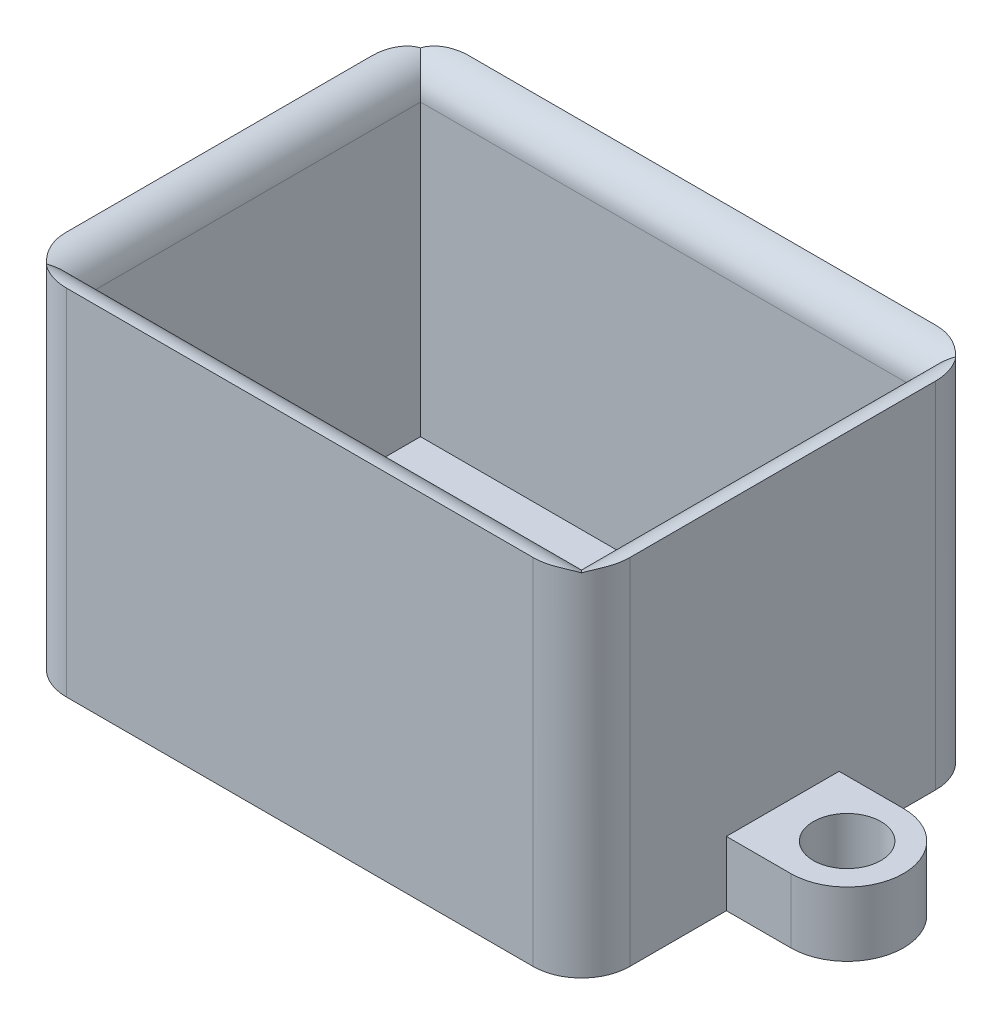
from build123d import *

# Parameters (mm, degrees)
SKETCH2_W           = 35
SKETCH2_H           = 25
SKETCH2_W_2         = 31
SKETCH2_H_2         = 21
BOSS_EXTRUDE1_DEPTH = 20
SKETCH3_W           = 35
SKETCH3_H           = 25
BOSS_EXTRUDE2_DEPTH = 2
SKETCH4_R           = 2.1
BOSS_EXTRUDE3_DEPTH = 4
FILLET1_R           = 3
FILLET2_R           = 2


with BuildPart() as part:
    # Sketch2 → Boss-Extrude1 (new body)
    with BuildSketch(Plane(origin=(0, 0, 0), x_dir=(1, 0, 0), z_dir=(0, 1, 0))):
        Rectangle(SKETCH2_W, SKETCH2_H)
        Rectangle(SKETCH2_W_2, SKETCH2_H_2, mode=Mode.SUBTRACT)
    extrude(amount=BOSS_EXTRUDE1_DEPTH)

    # Sketch3 → Boss-Extrude2 (add)
    with BuildSketch(Plane.XZ):
        Rectangle(SKETCH3_W, SKETCH3_H)
    extrude(amount=BOSS_EXTRUDE2_DEPTH)

    # Sketch4 → Boss-Extrude3 (add)
    # profile 1 of 2: a face of its own
    with BuildSketch(Plane.XZ.offset(2)):
        with BuildLine():
            Line((-21.5, 3.5), (-17.5, 3.5))
            Line((-17.5, 3.5), (-17.5, -3.5))
            Line((-17.5, -3.5), (-21.5, -3.5))
            ThreePointArc((-21.5, -3.5), (-25, 0), (-21.5, 3.5))
        make_face()
        with Locations(Location((-21.5, 0, 0), (0, 0, 270))):
            Circle(SKETCH4_R, mode=Mode.SUBTRACT)
    # profile 2 of 2: a face of its own
    with BuildSketch(Plane.XZ.offset(2)):
        with BuildLine():
            Line((17.5, 3.5), (17.5, -3.5))
            Line((17.5, -3.5), (21.5, -3.5))
            ThreePointArc((21.5, -3.5), (25, 0), (21.5, 3.5))
            Line((21.5, 3.5), (17.5, 3.5))
        make_face()
        with Locations(Location((21.5, 0, 0), (0, 0, 90))):
            Circle(SKETCH4_R, mode=Mode.SUBTRACT)
    extrude(amount=-BOSS_EXTRUDE3_DEPTH)

    # Fillet1
    fillet1_edges = [part.edges().sort_by_distance(p)[0] for p in [
        (17.5, 9, 12.5),
        (-17.5, 9, 12.5),
        (-17.5, 9, -12.5),
        (17.5, 9, -12.5),
    ]]
    fillet(fillet1_edges, radius=FILLET1_R)

    # Fillet2
    # the kernel refuses this fillet: 2 mm, written as the material it takes off along each edge
    with BuildSketch(Plane(origin=(15.5, 20, -10.5), x_dir=(1, 0, 0), z_dir=(0, 0, 1)), Plane(origin=(-15.5, 20, 10.5), x_dir=(-1, 0, 0), z_dir=(0, 0, -1))) as fillet2_piece_1:
        with BuildLine():
            CenterArc((FILLET2_R, -FILLET2_R), FILLET2_R, 90, 90)
            Line((0, -FILLET2_R), (-FILLET2_R * 0.02, -FILLET2_R))
            Line((-FILLET2_R * 0.02, -FILLET2_R), (-FILLET2_R * 0.02, FILLET2_R * 0.02))
            Line((-FILLET2_R * 0.02, FILLET2_R * 0.02), (FILLET2_R, FILLET2_R * 0.02))
            Line((FILLET2_R, FILLET2_R * 0.02), (FILLET2_R, 0))
        make_face()
    extrude(amount=21, mode=Mode.SUBTRACT)
    with BuildSketch(Plane(origin=(-15.5, 20, -10.5), x_dir=(0, 0, -1), z_dir=(1, 0, 0)), Plane(origin=(15.5, 20, 10.5), x_dir=(0, 0, 1), z_dir=(-1, 0, 0))) as fillet2_piece_2:
        with BuildLine():
            CenterArc((FILLET2_R, -FILLET2_R), FILLET2_R, 90, 90)
            Line((0, -FILLET2_R), (-FILLET2_R * 0.02, -FILLET2_R))
            Line((-FILLET2_R * 0.02, -FILLET2_R), (-FILLET2_R * 0.02, FILLET2_R * 0.02))
            Line((-FILLET2_R * 0.02, FILLET2_R * 0.02), (FILLET2_R, FILLET2_R * 0.02))
            Line((FILLET2_R, FILLET2_R * 0.02), (FILLET2_R, 0))
        make_face()
    extrude(amount=31, mode=Mode.SUBTRACT)
    with BuildSketch(Plane(origin=(15.5, 20, -15.5), x_dir=(1, 0, 0), z_dir=(0, 0, 1))) as fillet2_piece_3a_section:
        with BuildLine():
            CenterArc((FILLET2_R, -FILLET2_R), FILLET2_R, 90, 90)
            Line((0, -FILLET2_R), (-FILLET2_R * 0.02, -FILLET2_R))
            Line((-FILLET2_R * 0.02, -FILLET2_R), (-FILLET2_R * 0.02, FILLET2_R * 0.02))
            Line((-FILLET2_R * 0.02, FILLET2_R * 0.02), (FILLET2_R, FILLET2_R * 0.02))
            Line((FILLET2_R, FILLET2_R * 0.02), (FILLET2_R, 0))
        make_face()
    fillet2_piece_3a = extrude(amount=26, mode=Mode.PRIVATE)
    fillet2_piece_3a = split(fillet2_piece_3a, bisect_by=Plane(origin=(15.952790229, 19.547209771, -10.5), z_dir=(0, 0, -1)), keep=Keep.TOP, mode=Mode.PRIVATE)
    with BuildSketch(Plane(origin=(-15.5, 20, -10.5), x_dir=(0, 0, -1), z_dir=(1, 0, 0))) as fillet2_piece_3b_section:
        with BuildLine():
            CenterArc((FILLET2_R, -FILLET2_R), FILLET2_R, 90, 90)
            Line((0, -FILLET2_R), (-FILLET2_R * 0.02, -FILLET2_R))
            Line((-FILLET2_R * 0.02, -FILLET2_R), (-FILLET2_R * 0.02, FILLET2_R * 0.02))
            Line((-FILLET2_R * 0.02, FILLET2_R * 0.02), (FILLET2_R, FILLET2_R * 0.02))
            Line((FILLET2_R, FILLET2_R * 0.02), (FILLET2_R, 0))
        make_face()
    fillet2_piece_3b = extrude(amount=36, mode=Mode.PRIVATE)
    fillet2_piece_3b = split(fillet2_piece_3b, bisect_by=Plane(origin=(15.5, 19.547209771, -10.952790229), z_dir=(1, 0, 0)), keep=Keep.TOP, mode=Mode.PRIVATE)
    fillet2_piece_3 = fillet2_piece_3a & fillet2_piece_3b
    add(fillet2_piece_3, mode=Mode.SUBTRACT)
    with BuildSketch(Plane(origin=(20.5, 20, 10.5), x_dir=(0, 0, 1), z_dir=(-1, 0, 0))) as fillet2_piece_4a_section:
        with BuildLine():
            CenterArc((FILLET2_R, -FILLET2_R), FILLET2_R, 90, 90)
            Line((0, -FILLET2_R), (-FILLET2_R * 0.02, -FILLET2_R))
            Line((-FILLET2_R * 0.02, -FILLET2_R), (-FILLET2_R * 0.02, FILLET2_R * 0.02))
            Line((-FILLET2_R * 0.02, FILLET2_R * 0.02), (FILLET2_R, FILLET2_R * 0.02))
            Line((FILLET2_R, FILLET2_R * 0.02), (FILLET2_R, 0))
        make_face()
    fillet2_piece_4a = extrude(amount=36, mode=Mode.PRIVATE)
    fillet2_piece_4a = split(fillet2_piece_4a, bisect_by=Plane(origin=(15.5, 19.547209771, 10.952790229), z_dir=(1, 0, 0)), keep=Keep.TOP, mode=Mode.PRIVATE)
    with BuildSketch(Plane(origin=(15.5, 20, -10.5), x_dir=(1, 0, 0), z_dir=(0, 0, 1))) as fillet2_piece_4b_section:
        with BuildLine():
            CenterArc((FILLET2_R, -FILLET2_R), FILLET2_R, 90, 90)
            Line((0, -FILLET2_R), (-FILLET2_R * 0.02, -FILLET2_R))
            Line((-FILLET2_R * 0.02, -FILLET2_R), (-FILLET2_R * 0.02, FILLET2_R * 0.02))
            Line((-FILLET2_R * 0.02, FILLET2_R * 0.02), (FILLET2_R, FILLET2_R * 0.02))
            Line((FILLET2_R, FILLET2_R * 0.02), (FILLET2_R, 0))
        make_face()
    fillet2_piece_4b = extrude(amount=26, mode=Mode.PRIVATE)
    fillet2_piece_4b = split(fillet2_piece_4b, bisect_by=Plane(origin=(15.952790229, 19.547209771, 10.5), z_dir=(0, 0, 1)), keep=Keep.TOP, mode=Mode.PRIVATE)
    fillet2_piece_4 = fillet2_piece_4a & fillet2_piece_4b
    add(fillet2_piece_4, mode=Mode.SUBTRACT)
    with BuildSketch(Plane(origin=(-15.5, 20, 10.5), x_dir=(-1, 0, 0), z_dir=(0, 0, -1))) as fillet2_piece_5a_section:
        with BuildLine():
            CenterArc((FILLET2_R, -FILLET2_R), FILLET2_R, 90, 90)
            Line((0, -FILLET2_R), (-FILLET2_R * 0.02, -FILLET2_R))
            Line((-FILLET2_R * 0.02, -FILLET2_R), (-FILLET2_R * 0.02, FILLET2_R * 0.02))
            Line((-FILLET2_R * 0.02, FILLET2_R * 0.02), (FILLET2_R, FILLET2_R * 0.02))
            Line((FILLET2_R, FILLET2_R * 0.02), (FILLET2_R, 0))
        make_face()
    fillet2_piece_5a = extrude(amount=26, mode=Mode.PRIVATE)
    fillet2_piece_5a = split(fillet2_piece_5a, bisect_by=Plane(origin=(-15.952790229, 19.547209771, -10.5), z_dir=(0, 0, -1)), keep=Keep.TOP, mode=Mode.PRIVATE)
    with BuildSketch(Plane(origin=(-20.5, 20, -10.5), x_dir=(0, 0, -1), z_dir=(1, 0, 0))) as fillet2_piece_5b_section:
        with BuildLine():
            CenterArc((FILLET2_R, -FILLET2_R), FILLET2_R, 90, 90)
            Line((0, -FILLET2_R), (-FILLET2_R * 0.02, -FILLET2_R))
            Line((-FILLET2_R * 0.02, -FILLET2_R), (-FILLET2_R * 0.02, FILLET2_R * 0.02))
            Line((-FILLET2_R * 0.02, FILLET2_R * 0.02), (FILLET2_R, FILLET2_R * 0.02))
            Line((FILLET2_R, FILLET2_R * 0.02), (FILLET2_R, 0))
        make_face()
    fillet2_piece_5b = extrude(amount=36, mode=Mode.PRIVATE)
    fillet2_piece_5b = split(fillet2_piece_5b, bisect_by=Plane(origin=(-15.5, 19.547209771, -10.952790229), z_dir=(-1, 0, 0)), keep=Keep.TOP, mode=Mode.PRIVATE)
    fillet2_piece_5 = fillet2_piece_5a & fillet2_piece_5b
    add(fillet2_piece_5, mode=Mode.SUBTRACT)
    with BuildSketch(Plane(origin=(-15.5, 20, 15.5), x_dir=(-1, 0, 0), z_dir=(0, 0, -1))) as fillet2_piece_6a_section:
        with BuildLine():
            CenterArc((FILLET2_R, -FILLET2_R), FILLET2_R, 90, 90)
            Line((0, -FILLET2_R), (-FILLET2_R * 0.02, -FILLET2_R))
            Line((-FILLET2_R * 0.02, -FILLET2_R), (-FILLET2_R * 0.02, FILLET2_R * 0.02))
            Line((-FILLET2_R * 0.02, FILLET2_R * 0.02), (FILLET2_R, FILLET2_R * 0.02))
            Line((FILLET2_R, FILLET2_R * 0.02), (FILLET2_R, 0))
        make_face()
    fillet2_piece_6a = extrude(amount=26, mode=Mode.PRIVATE)
    fillet2_piece_6a = split(fillet2_piece_6a, bisect_by=Plane(origin=(-15.952790229, 19.547209771, 10.5), z_dir=(0, 0, 1)), keep=Keep.TOP, mode=Mode.PRIVATE)
    with BuildSketch(Plane(origin=(15.5, 20, 10.5), x_dir=(0, 0, 1), z_dir=(-1, 0, 0))) as fillet2_piece_6b_section:
        with BuildLine():
            CenterArc((FILLET2_R, -FILLET2_R), FILLET2_R, 90, 90)
            Line((0, -FILLET2_R), (-FILLET2_R * 0.02, -FILLET2_R))
            Line((-FILLET2_R * 0.02, -FILLET2_R), (-FILLET2_R * 0.02, FILLET2_R * 0.02))
            Line((-FILLET2_R * 0.02, FILLET2_R * 0.02), (FILLET2_R, FILLET2_R * 0.02))
            Line((FILLET2_R, FILLET2_R * 0.02), (FILLET2_R, 0))
        make_face()
    fillet2_piece_6b = extrude(amount=36, mode=Mode.PRIVATE)
    fillet2_piece_6b = split(fillet2_piece_6b, bisect_by=Plane(origin=(-15.5, 19.547209771, 10.952790229), z_dir=(-1, 0, 0)), keep=Keep.TOP, mode=Mode.PRIVATE)
    fillet2_piece_6 = fillet2_piece_6a & fillet2_piece_6b
    add(fillet2_piece_6, mode=Mode.SUBTRACT)


solid = part.part
